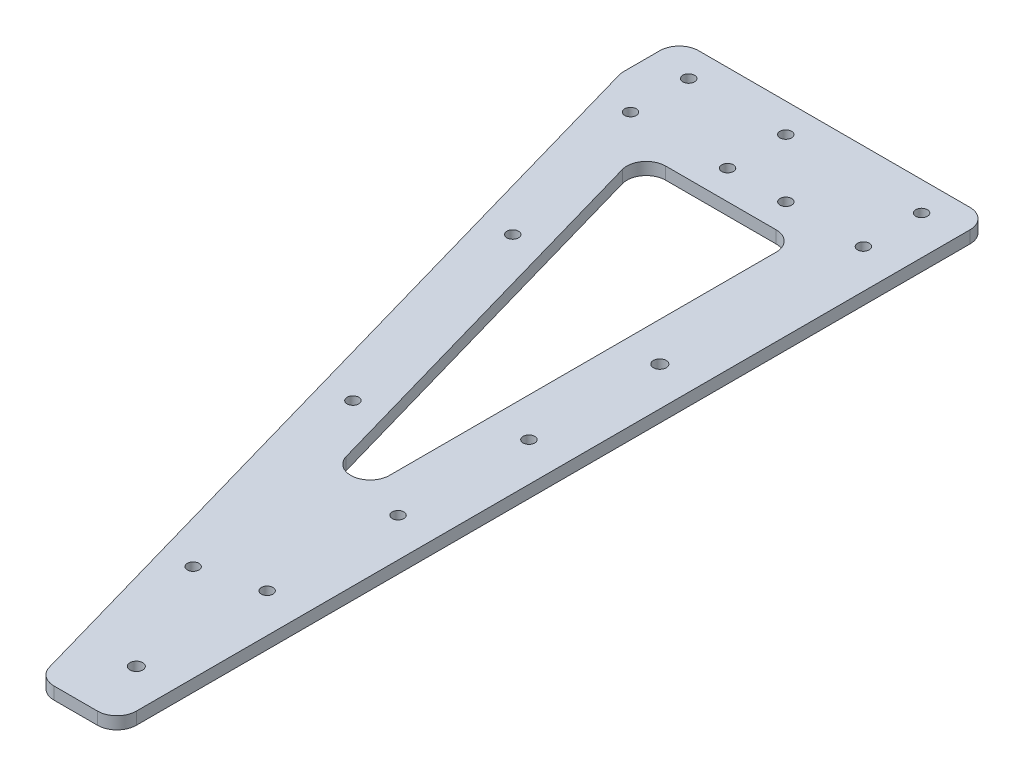
from build123d import *

# Parameters (mm, degrees)
SKETCH1_R           = 1.65
SKETCH1_R_2         = 1.5
BOSS_EXTRUDE1_DEPTH = 3.175
BOSS_EXTRUDE2_DEPTH = 3.175
FILLET1_R           = 5


with BuildPart() as part:
    # Sketch1 → Boss-Extrude1 (new body)
    with BuildSketch(Plane(origin=(0, 0, 0), x_dir=(1, 0, 0), z_dir=(0, 1, 0))):
        Polygon((-20, -210), (0, -210), (0, 0), (-80, 0), align=None)
        with Locations((-10, -195)):
            Circle(SKETCH1_R, mode=Mode.SUBTRACT)
        with Locations((-30, -7.5)):
            Circle(SKETCH1_R_2, mode=Mode.SUBTRACT)
        with Locations((-45.028512559, -7.5)):
            Circle(SKETCH1_R_2, mode=Mode.SUBTRACT)
        with Locations((-70.057025119, -7.5)):
            Circle(SKETCH1_R_2, mode=Mode.SUBTRACT)
        with Locations((-57.90606543, -50.028358912)):
            Circle(SKETCH1_R_2, mode=Mode.SUBTRACT)
        with Locations((-41.422797756, -107.71979577)):
            Circle(SKETCH1_R_2, mode=Mode.SUBTRACT)
        with Locations((-24.939530082, -165.411232629)):
            Circle(SKETCH1_R_2, mode=Mode.SUBTRACT)
        Polygon((-60.114050237, -15), (-20, -15), (-20, -155.39917583), align=None, mode=Mode.SUBTRACT)
        with BuildLine():
            ThreePointArc((-10, -162.75), (-11.5, -161.25), (-10, -159.75))
            ThreePointArc((-10, -159.75), (-8.5, -161.25), (-10, -162.75))
        make_face(mode=Mode.SUBTRACT)
        with BuildLine():
            ThreePointArc((-10, -129), (-11.5, -127.5), (-10, -126))
            ThreePointArc((-10, -126), (-8.5, -127.5), (-10, -129))
        make_face(mode=Mode.SUBTRACT)
        with BuildLine():
            ThreePointArc((-10, -95.25), (-11.5, -93.75), (-10, -92.25))
            ThreePointArc((-10, -92.25), (-8.5, -93.75), (-10, -95.25))
        make_face(mode=Mode.SUBTRACT)
        with Locations((-10, -60)):
            Circle(SKETCH1_R, mode=Mode.SUBTRACT)
        with Locations((-10, -7.5)):
            Circle(SKETCH1_R_2, mode=Mode.SUBTRACT)
    extrude(amount=BOSS_EXTRUDE1_DEPTH)

    # Sketch2 → Boss-Extrude2 (add)
    with BuildSketch(Plane.XZ):
        Polygon((-70.057025119, 0), (-80, 0), (-80, -15), (0, -15), (0, 0), (-10, 0), (-45.028512559, 0), align=None)
        with BuildLine():
            ThreePointArc((-68.557025119, -7.5), (-71.11768529, -8.560660172), (-70.057025119, -6))
            ThreePointArc((-70.057025119, -6), (-68.996364947, -6.439339828), (-68.557025119, -7.5))
        make_face(mode=Mode.SUBTRACT)
        with BuildLine():
            ThreePointArc((-43.528512559, -7.5), (-46.089172731, -8.560660172), (-45.028512559, -6))
            ThreePointArc((-45.028512559, -6), (-43.967852388, -6.439339828), (-43.528512559, -7.5))
        make_face(mode=Mode.SUBTRACT)
        with BuildLine():
            ThreePointArc((-8.5, -7.5), (-11.060660172, -8.560660172), (-10, -6))
            ThreePointArc((-10, -6), (-8.939339828, -6.439339828), (-8.5, -7.5))
        make_face(mode=Mode.SUBTRACT)
    extrude(amount=-BOSS_EXTRUDE2_DEPTH)

    # Fillet1
    fillet1_edges = [part.edges().sort_by_distance(p)[0] for p in [
        (-20, 1.5875, 155.39917583),
        (-20, 1.5875, 15),
        (-60.114050237, 1.5875, 15),
        (-80, 1.5875, -15),
        (0, 1.5875, -15),
        (0, 1.5875, 210),
        (-20, 1.5875, 210),
        (-80, 1.5875, 0),
    ]]
    fillet(fillet1_edges, radius=FILLET1_R)


solid = part.part
